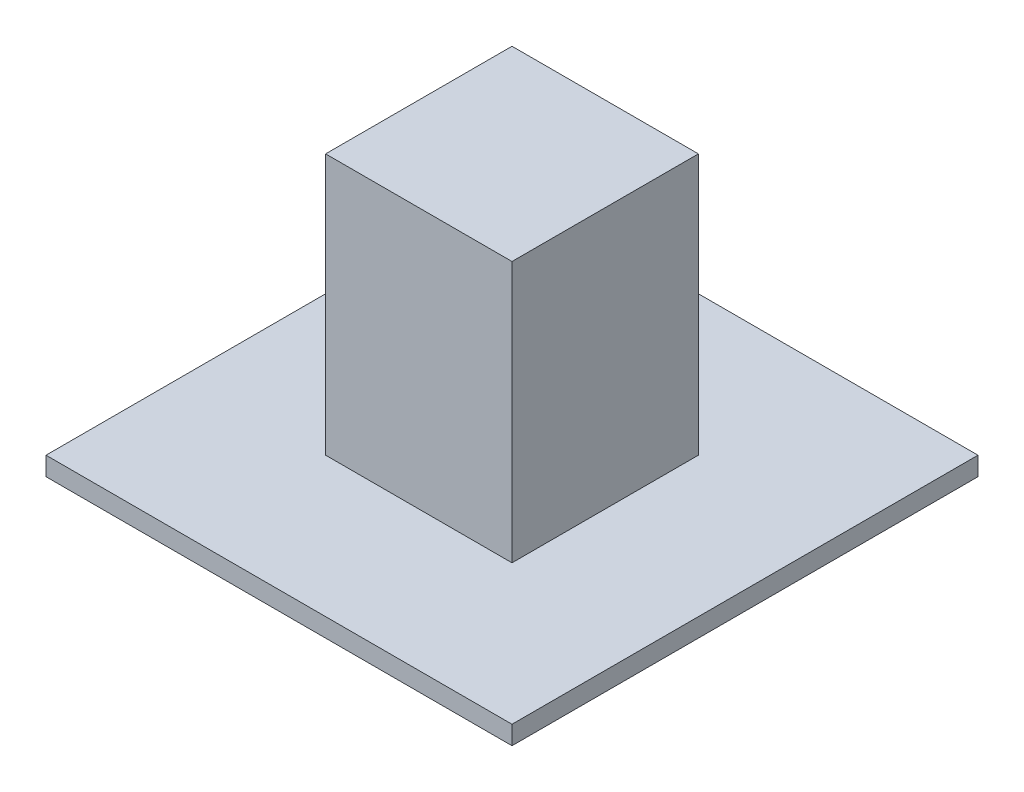
from build123d import *

# Parameters (mm, degrees)
SKETCH1_W           = 2
SKETCH1_H           = 2
BOSS_EXTRUDE1_DEPTH = 2.8
SKETCH2_W           = 5
SKETCH2_H           = 5
BOSS_EXTRUDE2_DEPTH = 0.2
SKETCH3_R           = 0.5
BOSS_EXTRUDE3_DEPTH = 1


with BuildPart() as part:
    # Sketch1 → Boss-Extrude1 (new body)
    with BuildSketch(Plane(origin=(0, 0, 0), x_dir=(1, 0, 0), z_dir=(0, 1, 0))):
        Rectangle(SKETCH1_W, SKETCH1_H)
    extrude(amount=BOSS_EXTRUDE1_DEPTH)

    # Sketch2 → Boss-Extrude2 (add)
    with BuildSketch(Plane(origin=(0, 0, 0), x_dir=(1, 0, 0), z_dir=(0, 1, 0))):
        Rectangle(SKETCH2_W, SKETCH2_H)
    extrude(amount=-BOSS_EXTRUDE2_DEPTH)

    # Sketch3 → Boss-Extrude3 (add)
    with BuildSketch(Plane(origin=(0, -0.2, 0), x_dir=(-1, 0, 0), z_dir=(0, -1, 0))):
        with Locations((-0.642767837, 0.980323434)):
            Circle(SKETCH3_R)
    extrude(amount=BOSS_EXTRUDE3_DEPTH)


solid = part.part
